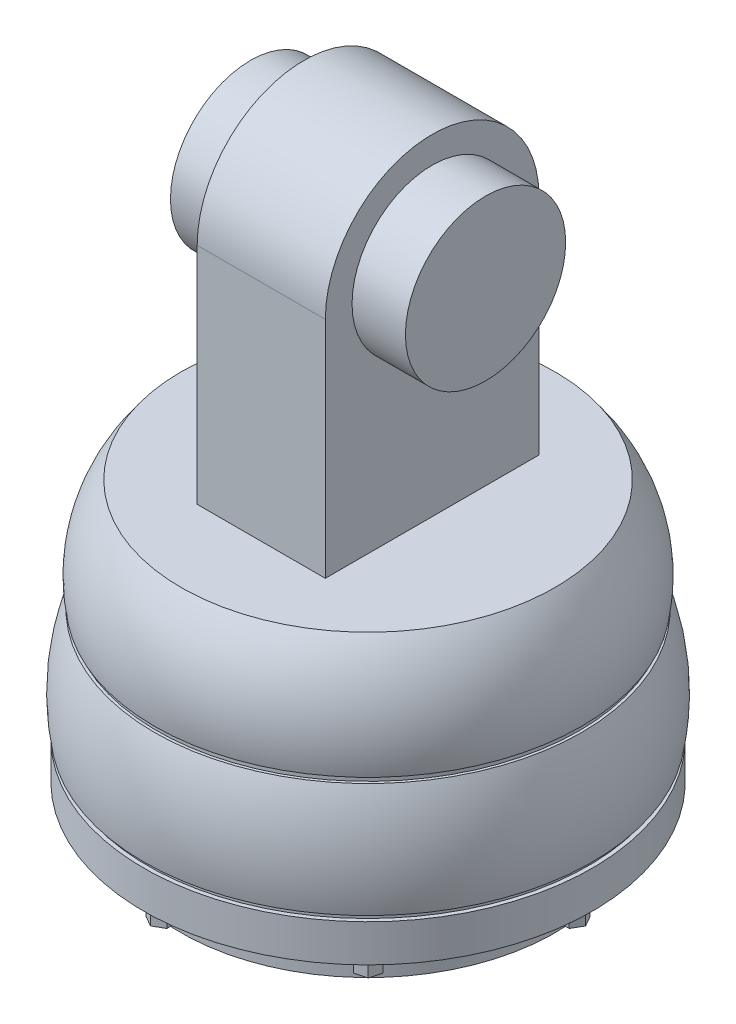
from build123d import *

# Parameters (mm, degrees)
ESQUISSE2_R                  = 39.5
BOSS_EXTRU_1_DEPTH           = 1
ESQUISSE4_R                  = 41.25
BOSS_EXTRU_2_DEPTH           = 1
ESQUISSE5_R                  = 42
BOSS_EXTRU_3_DEPTH           = 7
ESQUISSE6_R                  = 35
BOSS_EXTRU_4_DEPTH           = 7
BOSS_EXTRU_7_DEPTH           = 3
R_P_TITION_START             = -52
R_P_TITION_CIRCULAIRE1_DEPTH = 3
ESQUISSE8_R                  = 15
BOSS_EXTRU_8_DEPTH           = 10
ESQUISSE9_W                  = 24
ESQUISSE9_H                  = 40
BOSS_EXTRU_9_DEPTH           = 42
BOSS_EXTRU_10_DEPTH          = 24
ESQUISSE11_R                 = 15
BOSS_EXTRU_11_DEPTH          = 10
BOSS_EXTRU_12_START          = 10
ESQUISSE12_R                 = 15
BOSS_EXTRU_12_DEPTH          = 10


# Read off the part's stored shape, not the designer's step: Répétition circulaire1
with BuildPart() as part:
    # Esquisse1 → Révolution1 (revolve)
    with BuildSketch(Plane.XY):
        with BuildLine():
            Line((0, 0), (-35, 0))
            ThreePointArc((-35, 0), (-39.657515479, -9.46062113), (-40, -20))
            Line((-40, -20), (0, -20))
            Line((0, -20), (0, 0))
        make_face()
    revolve(axis=Axis((0, 0, 0), (0, -1, 0)))

    # Esquisse2 → Boss.-Extru.1 (add)
    with BuildSketch(Plane.XZ.offset(20)):
        Circle(ESQUISSE2_R)
    extrude(amount=BOSS_EXTRU_1_DEPTH)

    # Esquisse3 → Révolution2 (revolve)
    with BuildSketch(Plane(origin=(0, 0, 0), x_dir=(0, 0, -1), z_dir=(1, 0, 0)), mode=Mode.PRIVATE) as r_volution2_sk:
        with BuildLine():
            Line((0, -21), (-40, -21))
            ThreePointArc((-40, -21), (-42.384109041, -30.861589096), (-42, -41))
            Line((-42, -41), (0, -41))
            Line((0, -41), (0, -21))
        make_face()
    revolve(r_volution2_sk.sketch.rotate(Axis((0, -21, 0), (0, -1, 0)), 90), axis=Axis((0, -21, 0), (0, -1, 0)))

    # Esquisse4 → Boss.-Extru.2 (add)
    with BuildSketch(Plane.XZ.offset(41)):
        with Locations(Location((0, 0, 0), (0, 0, 270))):
            Circle(ESQUISSE4_R)
    extrude(amount=BOSS_EXTRU_2_DEPTH)

    # Esquisse5 → Boss.-Extru.3 (add)
    with BuildSketch(Plane.XZ.offset(42)):
        with Locations(Location((0, 0, 0), (0, 0, 270))):
            Circle(ESQUISSE5_R)
    extrude(amount=BOSS_EXTRU_3_DEPTH)

    # Esquisse6 → Boss.-Extru.4 (add)
    with BuildSketch(Plane.XZ.offset(49)):
        with Locations(Location((0, 0, 0), (0, 0, 270))):
            Circle(ESQUISSE6_R)
    extrude(amount=BOSS_EXTRU_4_DEPTH)

    # Esquisse7 → Boss.-Extru.7 (add)
    with BuildSketch(Plane.XZ.offset(49)):
        Polygon((39.629367086, -1.94603582), (40.75, 0.005042677), (39.620632914, 1.951078497), (37.370632914, 1.94603582), (36.25, -0.005042677), (37.379367086, -1.951078497), align=None)
        Polygon((39.045525279, 0.94978706), (37.950222917, 0.94733228), (37.404697638, -0.00245478), (37.954474721, -0.94978706), (39.049777083, -0.94733228), (39.595302362, 0.00245478), align=None, mode=Mode.SUBTRACT)
    extrude(amount=BOSS_EXTRU_7_DEPTH)

    # Répétition circulaire1 outline → Répétition circulaire1 (add)
    # profile 1 of 7: a face of its own
    with BuildSketch(Plane(origin=(0, 0, 0), x_dir=(1, 0, 0), z_dir=(0, 1, 0)).offset(R_P_TITION_START)):
        Polygon((29.398249326, -26.646139076), (27.810824779, -25.051583107), (25.636186529, -25.629055107), (25.048972826, -27.801083076), (26.636397373, -29.395639044), (28.811035623, -28.818167044), align=None)
        Polygon((28.282227258, -26.9424971), (27.996371011, -27.999842595), (26.937754829, -28.28095657), (26.164994893, -27.504725051), (26.45085114, -26.447379557), (27.509467323, -26.166265581), align=None, mode=Mode.SUBTRACT)
    # profile 2 of 7: a face of its own
    with BuildSketch(Plane(origin=(0, 0, 0), x_dir=(1, 0, 0), z_dir=(0, 1, 0)).offset(R_P_TITION_START)):
        Polygon((26.646139076, 29.398249326), (25.051583107, 27.810824779), (25.629055107, 25.636186529), (27.801083076, 25.048972826), (29.395639044, 26.636397373), (28.818167044, 28.811035623), align=None)
        Polygon((26.9424971, 28.282227258), (27.999842595, 27.996371011), (28.28095657, 26.937754829), (27.504725051, 26.164994893), (26.447379557, 26.45085114), (26.166265581, 27.509467323), align=None, mode=Mode.SUBTRACT)
    # profile 3 of 7: a face of its own
    with BuildSketch(Plane(origin=(0, 0, 0), x_dir=(1, 0, 0), z_dir=(0, 1, 0)).offset(R_P_TITION_START)):
        Polygon((-1.94603582, 39.629367086), (-1.951078497, 37.379367086), (-0.005042677, 36.25), (1.94603582, 37.370632914), (1.951078497, 39.620632914), (0.005042677, 40.75), align=None)
        Polygon((-0.94733228, 39.049777083), (0.00245478, 39.595302362), (0.94978706, 39.045525279), (0.94733228, 37.950222917), (-0.00245478, 37.404697638), (-0.94978706, 37.954474721), align=None, mode=Mode.SUBTRACT)
    # profile 4 of 7: a face of its own
    with BuildSketch(Plane(origin=(0, 0, 0), x_dir=(1, 0, 0), z_dir=(0, 1, 0)).offset(R_P_TITION_START)):
        Polygon((-29.398249326, 26.646139076), (-27.810824779, 25.051583107), (-25.636186529, 25.629055107), (-25.048972826, 27.801083076), (-26.636397373, 29.395639044), (-28.811035623, 28.818167044), align=None)
        Polygon((-28.282227258, 26.9424971), (-27.996371011, 27.999842595), (-26.937754829, 28.28095657), (-26.164994893, 27.504725051), (-26.45085114, 26.447379557), (-27.509467323, 26.166265581), align=None, mode=Mode.SUBTRACT)
    # profile 5 of 7: a face of its own
    with BuildSketch(Plane(origin=(0, 0, 0), x_dir=(1, 0, 0), z_dir=(0, 1, 0)).offset(R_P_TITION_START)):
        Polygon((-39.629367086, -1.94603582), (-37.379367086, -1.951078497), (-36.25, -0.005042677), (-37.370632914, 1.94603582), (-39.620632914, 1.951078497), (-40.75, 0.005042677), align=None)
        Polygon((-39.049777083, -0.94733228), (-39.595302362, 0.00245478), (-39.045525279, 0.94978706), (-37.950222917, 0.94733228), (-37.404697638, -0.00245478), (-37.954474721, -0.94978706), align=None, mode=Mode.SUBTRACT)
    # profile 6 of 7: a face of its own
    with BuildSketch(Plane(origin=(0, 0, 0), x_dir=(1, 0, 0), z_dir=(0, 1, 0)).offset(R_P_TITION_START)):
        Polygon((-26.646139076, -29.398249326), (-25.051583107, -27.810824779), (-25.629055107, -25.636186529), (-27.801083076, -25.048972826), (-29.395639044, -26.636397373), (-28.818167044, -28.811035623), align=None)
        Polygon((-26.9424971, -28.282227258), (-27.999842595, -27.996371011), (-28.28095657, -26.937754829), (-27.504725051, -26.164994893), (-26.447379557, -26.45085114), (-26.166265581, -27.509467323), align=None, mode=Mode.SUBTRACT)
    # profile 7 of 7: a face of its own
    with BuildSketch(Plane(origin=(0, 0, 0), x_dir=(1, 0, 0), z_dir=(0, 1, 0)).offset(R_P_TITION_START)):
        Polygon((1.94603582, -39.629367086), (1.951078497, -37.379367086), (0.005042677, -36.25), (-1.94603582, -37.370632914), (-1.951078497, -39.620632914), (-0.005042677, -40.75), align=None)
        Polygon((0.94733228, -39.049777083), (-0.00245478, -39.595302362), (-0.94978706, -39.045525279), (-0.94733228, -37.950222917), (0.00245478, -37.404697638), (0.94978706, -37.954474721), align=None, mode=Mode.SUBTRACT)
    extrude(amount=R_P_TITION_CIRCULAIRE1_DEPTH)

    # Esquisse8 → Boss.-Extru.8 (add)
    with BuildSketch(Plane.XZ.offset(56)):
        with Locations(Location((0, 0, 0), (0, 0, 270))):
            Circle(ESQUISSE8_R)
    extrude(amount=BOSS_EXTRU_8_DEPTH)

    # Esquisse9 → Boss.-Extru.9 (add)
    with BuildSketch(Plane(origin=(0, 0, 0), x_dir=(1, 0, 0), z_dir=(0, 1, 0))):
        Rectangle(ESQUISSE9_W, ESQUISSE9_H)
    extrude(amount=BOSS_EXTRU_9_DEPTH)

    # Esquisse10 → Boss.-Extru.10 (add)
    with BuildSketch(Plane.ZY.offset(12)):
        with BuildLine():
            Line((-20, 42), (20, 42))
            ThreePointArc((20, 42), (0, 62), (-20, 42))
        make_face()
    extrude(amount=-BOSS_EXTRU_10_DEPTH)

    # Esquisse11 → Boss.-Extru.11 (add)
    with BuildSketch(Plane(origin=(12, 0, 0), x_dir=(0, 0, -1), z_dir=(1, 0, 0))):
        with Locations(Location((0, 42, 0), (0, 0, 180))):
            Circle(ESQUISSE11_R)
    extrude(amount=BOSS_EXTRU_11_DEPTH)

    # Esquisse12 → Boss.-Extru.12 (add)
    with BuildSketch(Plane.ZY.offset(12).offset(BOSS_EXTRU_12_START)):
        with Locations((0, 42)):
            Circle(ESQUISSE12_R)
    extrude(amount=-BOSS_EXTRU_12_DEPTH)


solid = part.part
